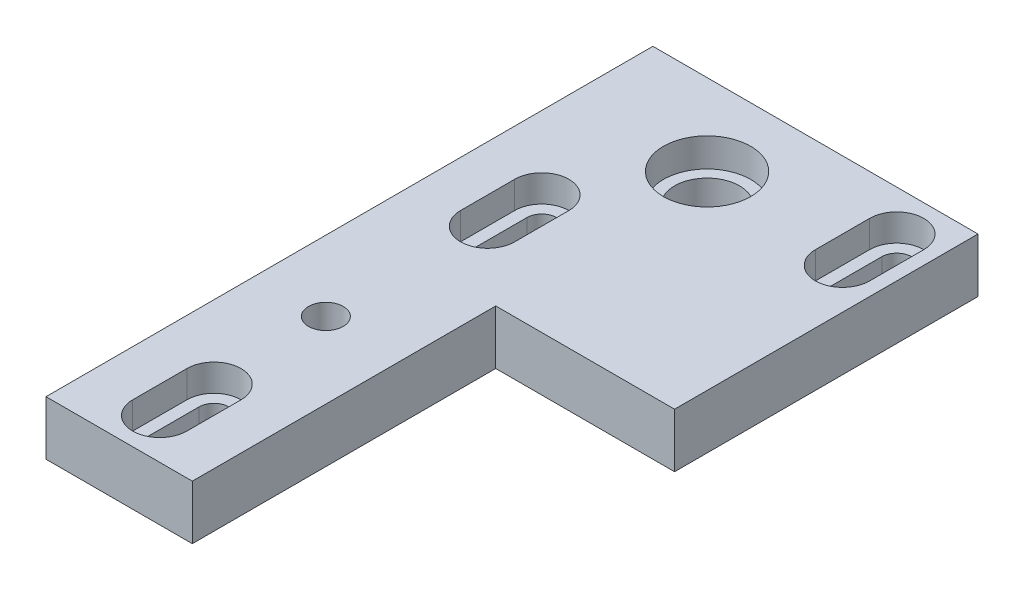
from build123d import *

# Parameters (mm, degrees)
BOSS_EXTRUDE1_DEPTH             = 10
CBORE_START                     = 5
CBORE_SLOT_FOR_M5_SHCS1_DEPTH   = 5
CBORE_SLOT_FOR_M5_SHCS1_2_DEPTH = 5
F_1_0MM_DOWEL_HOLE1_D           = 16.1
F_1_0MM_DOWEL_HOLE1_DEPTH       = 5.3
F_1_0MM_DOWEL_HOLE3_D           = 12
SKETCH14_R                      = 3.2
CUT_EXTRUDE1_DEPTH              = 77.249590163


# Read off the part's stored shape, not the designer's step: CBORE SLOT for M5 SHCS1
with BuildPart() as part:
    # Sketch1 → Boss-Extrude1 (new body)
    with BuildSketch(Plane(origin=(0, 0, 0), x_dir=(1, 0, 0), z_dir=(0, 1, 0))):
        Polygon((-25, 45), (35, 45), (35, -11), (2, -11), (2, -67), (-25, -67), align=None)
    extrude(amount=BOSS_EXTRUDE1_DEPTH)

    # CBORE SLOT for M5 SHCS1 outline → CBORE SLOT for M5 SHCS1 (cut)
    with BuildSketch(Plane(origin=(0, 0, 0), x_dir=(1, 0, 0), z_dir=(0, 1, 0)).offset(CBORE_START)):
        with BuildLine():
            Line((-6.5, -59.5), (-6.5, -49.5))
            ThreePointArc((-6.5, -49.5), (-11.5, -44.5), (-16.5, -49.5))
            Line((-16.5, -49.5), (-16.5, -59.5))
            ThreePointArc((-16.5, -59.5), (-11.5, -64.5), (-6.5, -59.5))
        make_face()
        with BuildLine():
            ThreePointArc((-6.5, 11), (-11.5, 16), (-16.5, 11))
            Line((-16.5, 11), (-16.5, 1))
            ThreePointArc((-16.5, 1), (-11.5, -4), (-6.5, 1))
            Line((-6.5, 1), (-6.5, 11))
        make_face()
        with BuildLine():
            Line((32.5, 27.5), (32.5, 37.5))
            ThreePointArc((32.5, 37.5), (27.5, 42.5), (22.5, 37.5))
            Line((22.5, 37.5), (22.5, 27.5))
            ThreePointArc((22.5, 27.5), (27.5, 22.5), (32.5, 27.5))
        make_face()
    extrude(amount=CBORE_SLOT_FOR_M5_SHCS1_DEPTH, mode=Mode.SUBTRACT)

    # CBORE SLOT for M5 SHCS1 2 outline → CBORE SLOT for M5 SHCS1 2 (cut)
    with BuildSketch(Plane(origin=(0, 0, 0), x_dir=(1, 0, 0), z_dir=(0, 1, 0))):
        with BuildLine():
            Line((-8.75, -59.5), (-8.75, -49.5))
            ThreePointArc((-8.75, -49.5), (-11.5, -46.75), (-14.25, -49.5))
            Line((-14.25, -49.5), (-14.25, -59.5))
            ThreePointArc((-14.25, -59.5), (-11.5, -62.25), (-8.75, -59.5))
        make_face()
        with BuildLine():
            ThreePointArc((-8.75, 11), (-11.5, 13.75), (-14.25, 11))
            Line((-14.25, 11), (-14.25, 1))
            ThreePointArc((-14.25, 1), (-11.5, -1.75), (-8.75, 1))
            Line((-8.75, 1), (-8.75, 11))
        make_face()
        with BuildLine():
            Line((30.25, 27.5), (30.25, 37.5))
            ThreePointArc((30.25, 37.5), (27.5, 40.25), (24.75, 37.5))
            Line((24.75, 37.5), (24.75, 27.5))
            ThreePointArc((24.75, 27.5), (27.5, 24.75), (30.25, 27.5))
        make_face()
    extrude(amount=CBORE_SLOT_FOR_M5_SHCS1_2_DEPTH, mode=Mode.SUBTRACT)

    # Ø1.0mm Dowel Hole1
    with Locations(Plane(origin=(0, 10, 0), x_dir=(1, 0, 0), z_dir=(0, 1, 0))):
        with Locations((0, 30)):
            Hole(F_1_0MM_DOWEL_HOLE1_D / 2, depth=F_1_0MM_DOWEL_HOLE1_DEPTH)

    # Ø1.0mm Dowel Hole3 (through all)
    with Locations(Plane(origin=(0, 4.7, 0), x_dir=(1, 0, 0), z_dir=(0, 1, 0))):
        with Locations((0, 30)):
            Hole(F_1_0MM_DOWEL_HOLE3_D / 2)

    # Sketch14 → Cut-Extrude1 (cut, through all)
    with BuildSketch(Plane(origin=(0, 10, 0), x_dir=(1, 0, 0), z_dir=(0, 1, 0))):
        with Locations((12, -28.35)):
            Circle(SKETCH14_R)
        with Locations(Location((-12, -28.35, 0), (0, 0, 270))):
            Circle(SKETCH14_R)
    extrude(amount=-CUT_EXTRUDE1_DEPTH, mode=Mode.SUBTRACT)


solid = part.part
